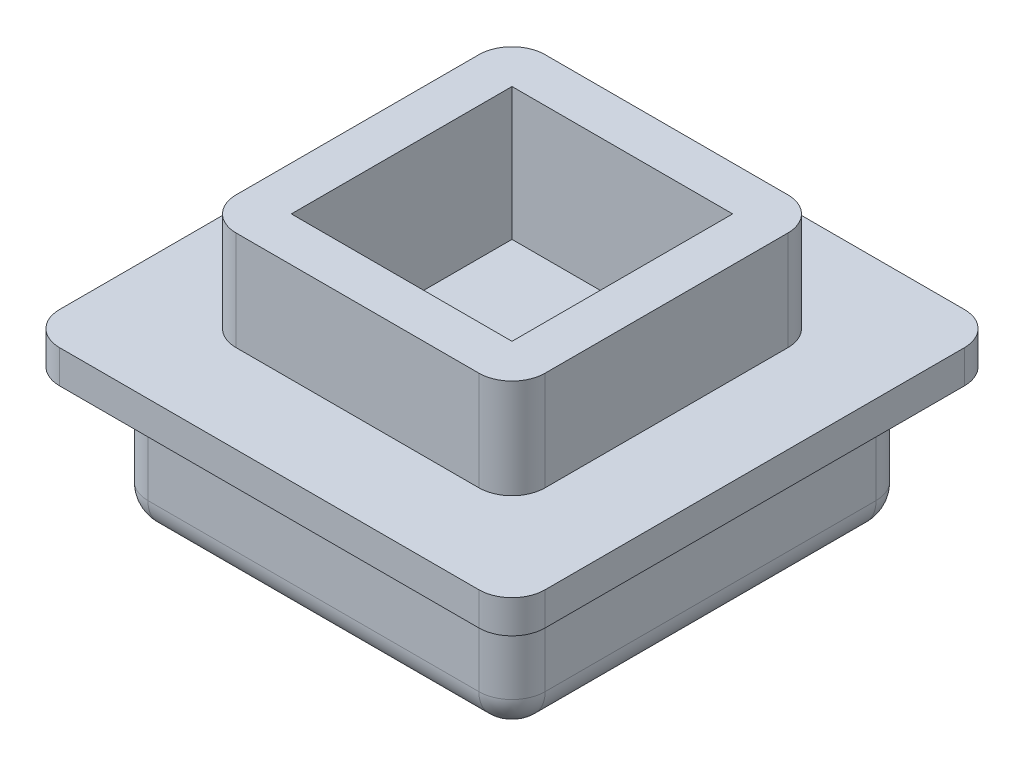
from build123d import *

# Parameters (mm, degrees)
SKETCH1_W           = 9
SKETCH1_H           = 9
BOSS_EXTRUDE1_DEPTH = 3
SKETCH2_W           = 11
SKETCH2_H           = 11
BOSS_EXTRUDE2_DEPTH = 0.75
SKETCH3_W           = 7
SKETCH3_H           = 7
SKETCH3_W_2         = 5
SKETCH3_H_2         = 5
BOSS_EXTRUDE3_DEPTH = 2.25
FILLET1_R           = 0.75
FILLET2_R           = 0.75
SKETCH4_W           = 5
SKETCH4_H           = 5
CUT_EXTRUDE1_DEPTH  = 0.75


with BuildPart() as part:
    # Sketch1 → Boss-Extrude1 (new body)
    with BuildSketch(Plane(origin=(0, 0, 0), x_dir=(1, 0, 0), z_dir=(0, 1, 0))):
        Rectangle(SKETCH1_W, SKETCH1_H)
    extrude(amount=BOSS_EXTRUDE1_DEPTH)

    # Sketch2 → Boss-Extrude2 (add)
    with BuildSketch(Plane(origin=(0, 3, 0), x_dir=(1, 0, 0), z_dir=(0, 1, 0))):
        Rectangle(SKETCH2_W, SKETCH2_H)
    extrude(amount=BOSS_EXTRUDE2_DEPTH)

    # Sketch3 → Boss-Extrude3 (add)
    with BuildSketch(Plane(origin=(0, 3.75, 0), x_dir=(1, 0, 0), z_dir=(0, 1, 0))):
        Rectangle(SKETCH3_W, SKETCH3_H)
        Rectangle(SKETCH3_W_2, SKETCH3_H_2, mode=Mode.SUBTRACT)
    extrude(amount=BOSS_EXTRUDE3_DEPTH)

    # Fillet1
    fillet1_edges = [part.edges().sort_by_distance(p)[0] for p in [
        (-3.5, 4.875, 3.5),
        (-3.5, 4.875, -3.5),
        (3.5, 4.875, -3.5),
        (3.5, 4.875, 3.5),
        (5.5, 3.375, 5.5),
        (-5.5, 3.375, 5.5),
        (-5.5, 3.375, -5.5),
        (5.5, 3.375, -5.5),
        (4.5, 1.5, -4.5),
        (-4.5, 1.5, -4.5),
        (-4.5, 1.5, 4.5),
        (4.5, 1.5, 4.5),
    ]]
    fillet(fillet1_edges, radius=FILLET1_R)

    # Fillet2
    fillet2_edges = [part.edges().sort_by_distance(p)[0] for p in [
        (4.280330086, 0, -4.280330086),
        (4.5, 0, 0),
        (4.280330086, 0, 4.280330086),
        (0, 0, 4.5),
        (-4.280330086, 0, 4.280330086),
        (-4.5, 0, 0),
        (-4.280330086, 0, -4.280330086),
        (0, 0, -4.5),
    ]]
    fillet(fillet2_edges, radius=FILLET2_R)

    # Sketch4 → Cut-Extrude1 (cut)
    with BuildSketch(Plane(origin=(0, 3.75, 0), x_dir=(1, 0, 0), z_dir=(0, 1, 0))):
        Rectangle(SKETCH4_W, SKETCH4_H)
    extrude(amount=-CUT_EXTRUDE1_DEPTH, mode=Mode.SUBTRACT)


solid = part.part
